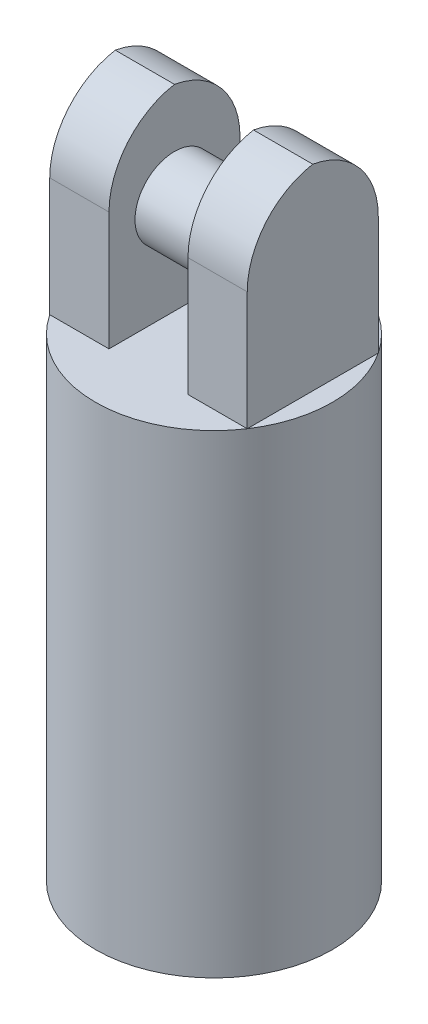
from build123d import *

# Parameters (mm, degrees)
SKETCH1_R           = 38.1
BOSS_EXTRUDE1_DEPTH = 152.4
SKETCH2_W           = 63.5
SKETCH2_H           = 42.121134838
BOSS_EXTRUDE2_DEPTH = 63.5
SKETCH3_W           = 25.4
SKETCH3_H           = 42.121134838
CUT_EXTRUDE1_DEPTH  = 63.5
FILLET1_R           = 25.4
SKETCH5_R           = 25.4
CUT_EXTRUDE3_DEPTH  = 50.8
SKETCH4_R           = 12.7
BOSS_EXTRUDE3_DEPTH = 52.578


with BuildPart() as part:
    # Sketch1 → Boss-Extrude1 (new body)
    with BuildSketch(Plane(origin=(0, 0, 0), x_dir=(1, 0, 0), z_dir=(0, 1, 0))):
        with Locations(Location((0, 0, 0), (0, 0, 90))):
            Circle(SKETCH1_R)
    extrude(amount=BOSS_EXTRUDE1_DEPTH)

    # Sketch2 → Boss-Extrude2 (add)
    with BuildSketch(Plane(origin=(0, 152.4, 0), x_dir=(1, 0, 0), z_dir=(0, 1, 0))):
        Rectangle(SKETCH2_W, SKETCH2_H)
    extrude(amount=BOSS_EXTRUDE2_DEPTH)

    # Sketch3 → Cut-Extrude1 (cut)
    with BuildSketch(Plane(origin=(0, 215.9, 0), x_dir=(1, 0, 0), z_dir=(0, 1, 0))):
        Rectangle(SKETCH3_W, SKETCH3_H)
    extrude(amount=-CUT_EXTRUDE1_DEPTH, mode=Mode.SUBTRACT)

    # Fillet1
    # the kernel refuses this fillet: 25.4 mm, written as the material it takes off along each edge
    with BuildSketch(Plane(origin=(50.8, 215.9, -21.060567419), x_dir=(0, -1, 0), z_dir=(-1, 0, 0)), Plane(origin=(-95.25, 215.9, 21.060567419), x_dir=(0, -1, 0), z_dir=(1, 0, 0)), Plane(origin=(95.25, 215.9, -21.060567419), x_dir=(0, -1, 0), z_dir=(-1, 0, 0)), Plane(origin=(-50.8, 215.9, 21.060567419), x_dir=(0, -1, 0), z_dir=(1, 0, 0))) as fillet1_piece_1:
        with BuildLine():
            CenterArc((FILLET1_R, FILLET1_R), FILLET1_R, 180, 90)
            Line((0, FILLET1_R), (0, 0))
            Line((0, 0), (FILLET1_R, 0))
        make_face()
    extrude(amount=146.05, mode=Mode.SUBTRACT)

    # Sketch5 → Cut-Extrude3 (cut)
    with BuildSketch(Plane.XZ):
        with Locations(Location((0, 0, 0), (0, 0, 270))):
            Circle(SKETCH5_R)
    extrude(amount=-CUT_EXTRUDE3_DEPTH, mode=Mode.SUBTRACT)

    # Sketch4 → Boss-Extrude3 (add)
    with BuildSketch(Plane(origin=(31.75, 0, 0), x_dir=(0, 0, -1), z_dir=(1, 0, 0))):
        with Locations((0, 184.15)):
            Circle(SKETCH4_R)
    extrude(amount=-BOSS_EXTRUDE3_DEPTH)


solid = part.part
